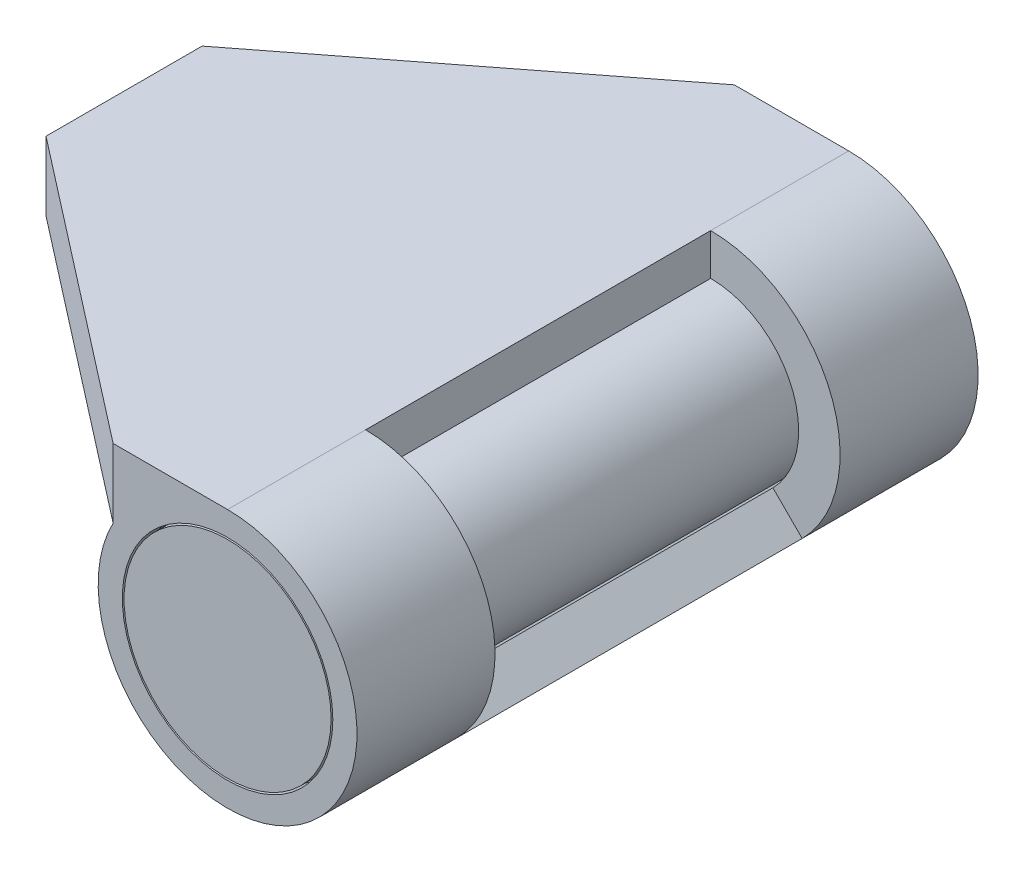
from build123d import *

# Parameters (mm, degrees)
SKETCH2_R           = 2.5
BOSS_EXTRUDE1_DEPTH = 8
SKETCH3_R           = 3.75
SKETCH3_R_2         = 2.55
BOSS_EXTRUDE2_DEPTH = 8.5
SKETCH4_R           = 3
BOSS_EXTRUDE3_DEPTH = 1
CHAMFER2_SIZE       = 0.5
CHAMFER3_SIZE       = 0.5
SKETCH6_R           = 3.75
SKETCH6_R_2         = 3.05
BOSS_EXTRUDE5_DEPTH = 0.5
CUT_EXTRUDE1_DEPTH  = 5
BOSS_EXTRUDE7_DEPTH = 9
CUT_EXTRUDE2_DEPTH  = 9
MIRROR1_START       = -8
MIRROR1_2_DEPTH     = 8
MIRROR1_START_2     = -9
MIRROR1_3_OUTLINE_R = 3.05
MIRROR1_3_DEPTH     = 4
MIRROR1_4_DEPTH     = 3
MIRROR1_START_3     = -15
MIRROR1_5_OUTLINE_W = 14
MIRROR1_5_OUTLINE_H = 2
MIRROR1_5_DEPTH     = 5.856362277


with BuildPart() as part:
    # Sketch2 → Boss-Extrude1 (new body)
    with BuildSketch(Plane.XY):
        Circle(SKETCH2_R)
    extrude(amount=BOSS_EXTRUDE1_DEPTH)

    # Sketch4 → Boss-Extrude3 (add)
    with BuildSketch(Plane.XY.offset(8)):
        Circle(SKETCH4_R)
    extrude(amount=BOSS_EXTRUDE3_DEPTH)

    # Chamfer2
    chamfer2_edges = [part.edges().sort_by_distance(p)[0] for p in [
        (-3, 0, 8),
    ]]
    chamfer(chamfer2_edges, length=CHAMFER2_SIZE - 0.0001)  # a hair under: the kernel refuses the full size

    # Mirror1 6 outline → Mirror1 6 (revolve)
    with BuildSketch(Plane.XZ):
        Polygon((2.5, -8), (2.5, 0), (0, 0), (0, -9), (3, -9), (3, -8.5), align=None)
    revolve(axis=Axis((0, 0, 0), (0, 0, 1)))


with BuildPart() as body_2:
    # Sketch3 → Boss-Extrude2 (new body)
    with BuildSketch(Plane.XY):
        Circle(SKETCH3_R)
        Circle(SKETCH3_R_2, mode=Mode.SUBTRACT)
    extrude(amount=BOSS_EXTRUDE2_DEPTH)

    # Chamfer3
    chamfer3_edges = [body_2.edges().sort_by_distance(p)[0] for p in [
        (-2.55, 0, 8.5),
    ]]
    chamfer(chamfer3_edges, length=CHAMFER3_SIZE)

    # Sketch6 → Boss-Extrude5 (add)
    with BuildSketch(Plane.XY.offset(8.5)):
        Circle(SKETCH6_R)
        Circle(SKETCH6_R_2, mode=Mode.SUBTRACT)
    extrude(amount=BOSS_EXTRUDE5_DEPTH)

    # Sketch7 → Cut-Extrude1 (cut)
    with BuildSketch(Plane.XY):
        with BuildLine():
            Line((0, 2.51516471), (0, 3.75))
            ThreePointArc((0, 3.75), (3.464548247, 1.435062871), (2.651650429, -2.651650429))
            Line((2.651650429, -2.651650429), (1.778490022, -1.778490022))
            ThreePointArc((1.778490022, -1.778490022), (2.323709197, 0.962511864), (0, 2.51516471))
        make_face()
    extrude(amount=CUT_EXTRUDE1_DEPTH, mode=Mode.SUBTRACT)

    # Sketch8 → Boss-Extrude7 (add)
    with BuildSketch(Plane.XY):
        with BuildLine():
            Line((0, 3.75), (-12, 3.75))
            Line((-12, 3.75), (-12, 1.75))
            Line((-12, 1.75), (-3.031088913, 1.75))
            ThreePointArc((-3.031088913, 1.75), (-1.75, 3.031088913), (0, 3.5))
            Line((0, 3.5), (0, 3.75))
        make_face()
    extrude(amount=BOSS_EXTRUDE7_DEPTH)

    # Sketch9 → Cut-Extrude2 (cut)
    with BuildSketch(Plane.XZ.offset(-1.75)):
        Polygon((-3.31662479, 9), (-12, 2.261889819), (-12, 9), align=None)
    extrude(amount=-CUT_EXTRUDE2_DEPTH, mode=Mode.SUBTRACT)

    # Mirror1: read off the stored shape, not the designer's step
    # Mirror1 outline → Mirror1 (revolve)
    with BuildSketch(Plane.XZ):
        Polygon((2.55, -8), (3.05, -8.5), (3.05, -8), align=None)
    revolve(axis=Axis((0, 0, 0), (0, 0, 1)))

    # Mirror1 2 outline → Mirror1 2 (add)
    with BuildSketch(Plane.XY.offset(MIRROR1_START)):
        with BuildLine():
            Line((0, 3.75), (-12, 3.75))
            Line((-12, 3.75), (-12, 1.75))
            Line((-12, 1.75), (-3.31662479, 1.75))
            ThreePointArc((-3.31662479, 1.75), (-2.225798587, -3.017999445), (2.65165043, -2.65165043))
            Line((2.65165043, -2.65165043), (1.803122292, -1.803122292))
            ThreePointArc((1.803122292, -1.803122292), (-2.355892808, -0.975842753), (0, 2.55))
            Line((0, 2.55), (0, 3.75))
        make_face()
    extrude(amount=MIRROR1_2_DEPTH)

    # Mirror1 3 outline → Mirror1 3 (add)
    with BuildSketch(Plane.XY.offset(MIRROR1_START_2)):
        with BuildLine():
            Line((0, 3.75), (-12, 3.75))
            Line((-12, 3.75), (-12, 1.75))
            Line((-12, 1.75), (-3.31662479, 1.75))
            ThreePointArc((-3.31662479, 1.75), (1.936491674, -3.211308145), (0, 3.75))
        make_face()
        Circle(MIRROR1_3_OUTLINE_R, mode=Mode.SUBTRACT)
    extrude(amount=MIRROR1_3_DEPTH)

    # Mirror1 4 outline → Mirror1 4 (add)
    with BuildSketch(Plane.XY.offset(MIRROR1_START)):
        with BuildLine():
            ThreePointArc((2.156675683, -2.156675683), (2.817832574, 1.167184469), (0, 3.05))
            Line((0, 3.05), (0, 2.55))
            ThreePointArc((0, 2.55), (2.355892808, 0.975842753), (1.803122292, -1.803122292))
            Line((1.803122292, -1.803122292), (2.156675683, -2.156675683))
        make_face()
    extrude(amount=MIRROR1_4_DEPTH)

    # Mirror1 5 outline → Mirror1 5 (cut)
    with BuildSketch(Plane(origin=(0, 0, 0), x_dir=(0.7900407033397415, 0, -0.6130543916052199), z_dir=(0.6130543916052199, 0, 0.7900407033397417)).offset(MIRROR1_START_3)):
        with Locations((-3, 2.75)):
            Rectangle(MIRROR1_5_OUTLINE_W, MIRROR1_5_OUTLINE_H)
    extrude(amount=MIRROR1_5_DEPTH, mode=Mode.SUBTRACT)


solid = Compound([part.part, body_2.part])
